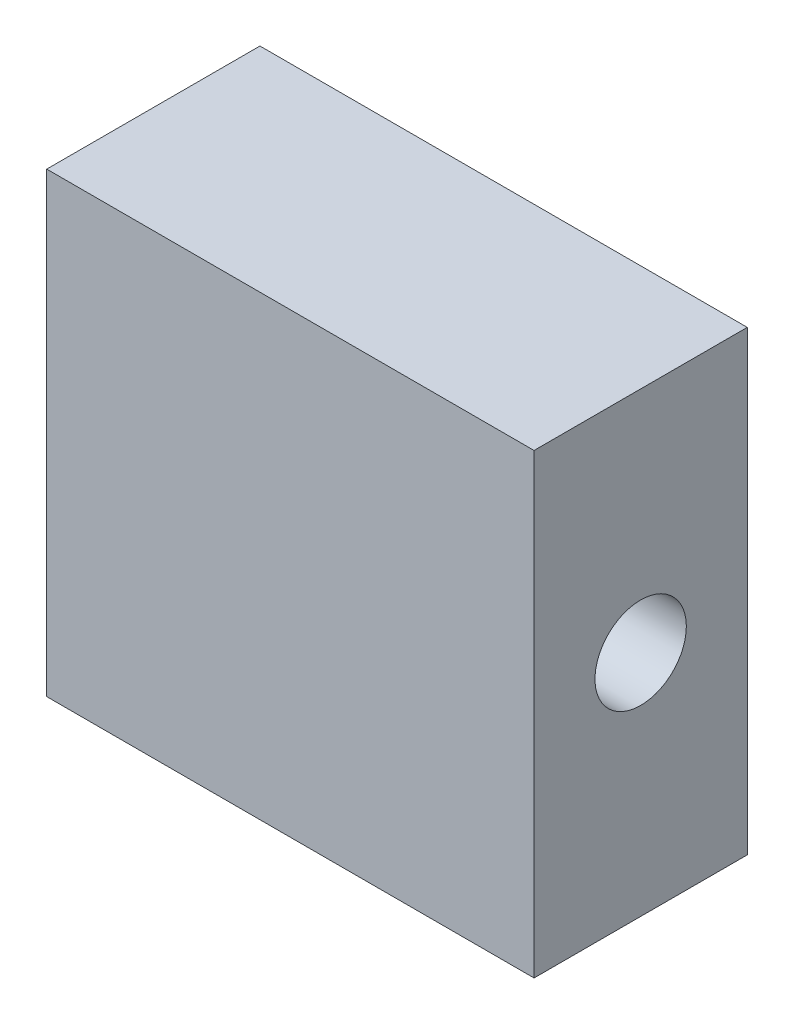
from build123d import *

# Parameters (mm, degrees)
SKETCH1_W                 = 32
SKETCH1_H                 = 30
BOSS_EXTRUDE1_DEPTH       = 7
M3X0_5_TAPPED_HOLE1_D     = 2.5
M3X0_5_TAPPED_HOLE1_DEPTH = 7.5
M3X0_5_TAPPED_HOLE1_TIP   = 0.751075774
M6X1_0_TAPPED_HOLE1_D     = 6


with BuildPart() as part:
    # Sketch1 → Boss-Extrude1 (new, symmetric)
    with BuildSketch(Plane.XY):
        Rectangle(SKETCH1_W, SKETCH1_H)
    extrude(amount=BOSS_EXTRUDE1_DEPTH, both=True)

    # M3x0.5 Tapped Hole1
    with Locations(Plane(origin=(0, 0, -7), x_dir=(-1, 0, 0), z_dir=(0, 0, -1))):
        with Locations((-10.666666667, 10), (10.666666667, 10), (10.666666667, -10), (-10.666666667, -10)):
            Hole(M3X0_5_TAPPED_HOLE1_D / 2, depth=M3X0_5_TAPPED_HOLE1_DEPTH)
            with Locations((0, 0, -(M3X0_5_TAPPED_HOLE1_DEPTH + M3X0_5_TAPPED_HOLE1_TIP / 2))):  # 118° drill point
                Cone(0, M3X0_5_TAPPED_HOLE1_D / 2, M3X0_5_TAPPED_HOLE1_TIP, mode=Mode.SUBTRACT)

    # M6x1.0 Tapped Hole1 (through all)
    with Locations(Plane(origin=(16, 0, 0), x_dir=(0, 0, -1), z_dir=(1, 0, 0))):
        with Locations((0, 0)):
            Hole(M6X1_0_TAPPED_HOLE1_D / 2)


solid = part.part
